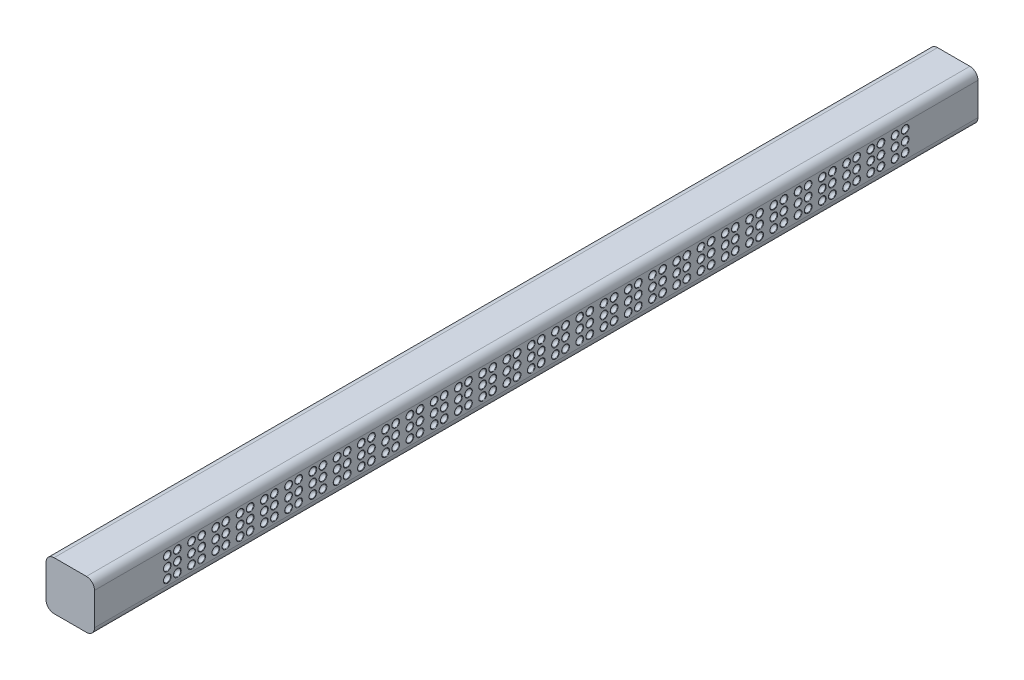
from build123d import *

# Parameters (mm, degrees)
BOSS_EXTRUDE1_DEPTH    = 218.5
SKETCH3_R              = 0.875
CUT_EXTRUDE1_DEPTH     = 1
FILLET1_R              = 0.875
FILLET2_R              = 0.1
LPATTERN1_COUNT        = 31
LPATTERN1_PITCH        = 6
FILLET1_OF_LPATTERN1_R = 0.875
FILLET2_OF_LPATTERN1_R = 0.1


with BuildPart() as part:
    # Sketch2 → Boss-Extrude1 (new body)
    with BuildSketch(Plane.XY):
        with BuildLine():
            Line((-4, 6), (4, 6))
            ThreePointArc((4, 6), (5.414213562, 5.414213562), (6, 4))
            Line((6, 4), (6, -4))
            ThreePointArc((6, -4), (5.414213562, -5.414213562), (4, -6))
            Line((4, -6), (-4, -6))
            ThreePointArc((-4, -6), (-5.414213562, -5.414213562), (-6, -4))
            Line((-6, -4), (-6, 4))
            ThreePointArc((-6, 4), (-5.414213562, 5.414213562), (-4, 6))
        make_face()
    extrude(amount=BOSS_EXTRUDE1_DEPTH)

    # Sketch3 → Cut-Extrude1 (cut)
    with BuildSketch(Plane(origin=(6, 0, 0), x_dir=(0, 0, -1), z_dir=(1, 0, 0))):
        with Locations((-20.5, -2.5)):
            Circle(SKETCH3_R)
        with Locations((-18, -2.5)):
            Circle(SKETCH3_R)
        with Locations((-18, 0)):
            Circle(SKETCH3_R)
        with Locations((-18, 2.5)):
            Circle(SKETCH3_R)
        with Locations((-20.5, 0)):
            Circle(SKETCH3_R)
        with Locations((-20.5, 2.5)):
            Circle(SKETCH3_R)
    cut_extrude1 = extrude(amount=-CUT_EXTRUDE1_DEPTH, mode=Mode.SUBTRACT)

    # Fillet1
    fillet1_edges = [part.edges().sort_by_distance(p)[0] for p in [
        (5, 2.5, 18.875),
        (5, 2.5, 21.375),
        (5, 0, 21.375),
        (5, 0, 18.875),
        (5, -2.5, 18.875),
        (5, -2.5, 21.375),
    ]]
    fillet(fillet1_edges, radius=FILLET1_R)

    # Fillet2
    fillet2_edges = [part.edges().sort_by_distance(p)[0] for p in [
        (6, -2.5, 18.875),
        (6, -2.5, 21.375),
        (6, 0, 21.375),
        (6, 2.5, 21.375),
        (6, 2.5, 18.875),
        (6, 0, 18.875),
    ]]
    fillet(fillet2_edges, radius=FILLET2_R)

    # LPattern1: Cut-Extrude1 ×31
    with Locations(*[(0, 0, i * LPATTERN1_PITCH) for i in range(1, LPATTERN1_COUNT)]):
        add(cut_extrude1, mode=Mode.SUBTRACT)

    # Fillet1 of LPattern1
    fillet1_of_lpattern1_edges = [part.edges().sort_by_distance(p)[0] for p in [
        (5, 2.5, 24.875),
        (5, 2.5, 27.375),
        (5, 0, 27.375),
        (5, 0, 24.875),
        (5, -2.5, 24.875),
        (5, -2.5, 27.375),
        (5, 2.5, 30.875),
        (5, 2.5, 33.375),
        (5, 0, 33.375),
        (5, 0, 30.875),
        (5, -2.5, 30.875),
        (5, -2.5, 33.375),
        (5, 2.5, 36.875),
        (5, 2.5, 39.375),
        (5, 0, 39.375),
        (5, 0, 36.875),
        (5, -2.5, 36.875),
        (5, -2.5, 39.375),
        (5, 2.5, 42.875),
        (5, 2.5, 45.375),
        (5, 0, 45.375),
        (5, 0, 42.875),
        (5, -2.5, 42.875),
        (5, -2.5, 45.375),
        (5, 2.5, 48.875),
        (5, 2.5, 51.375),
        (5, 0, 51.375),
        (5, 0, 48.875),
        (5, -2.5, 48.875),
        (5, -2.5, 51.375),
        (5, 2.5, 54.875),
        (5, 2.5, 57.375),
        (5, 0, 57.375),
        (5, 0, 54.875),
        (5, -2.5, 54.875),
        (5, -2.5, 57.375),
        (5, 2.5, 60.875),
        (5, 2.5, 63.375),
        (5, 0, 63.375),
        (5, 0, 60.875),
        (5, -2.5, 60.875),
        (5, -2.5, 63.375),
        (5, 2.5, 66.875),
        (5, 2.5, 69.375),
        (5, 0, 69.375),
        (5, 0, 66.875),
        (5, -2.5, 66.875),
        (5, -2.5, 69.375),
        (5, 2.5, 72.875),
        (5, 2.5, 75.375),
        (5, 0, 75.375),
        (5, 0, 72.875),
        (5, -2.5, 72.875),
        (5, -2.5, 75.375),
        (5, 2.5, 78.875),
        (5, 2.5, 81.375),
        (5, 0, 81.375),
        (5, 0, 78.875),
        (5, -2.5, 78.875),
        (5, -2.5, 81.375),
        (5, 2.5, 84.875),
        (5, 2.5, 87.375),
        (5, 0, 87.375),
        (5, 0, 84.875),
        (5, -2.5, 84.875),
        (5, -2.5, 87.375),
        (5, 2.5, 90.875),
        (5, 2.5, 93.375),
        (5, 0, 93.375),
        (5, 0, 90.875),
        (5, -2.5, 90.875),
        (5, -2.5, 93.375),
        (5, 2.5, 96.875),
        (5, 2.5, 99.375),
        (5, 0, 99.375),
        (5, 0, 96.875),
        (5, -2.5, 96.875),
        (5, -2.5, 99.375),
        (5, 2.5, 102.875),
        (5, 2.5, 105.375),
        (5, 0, 105.375),
        (5, 0, 102.875),
        (5, -2.5, 102.875),
        (5, -2.5, 105.375),
        (5, 2.5, 108.875),
        (5, 2.5, 111.375),
        (5, 0, 111.375),
        (5, 0, 108.875),
        (5, -2.5, 108.875),
        (5, -2.5, 111.375),
        (5, 2.5, 114.875),
        (5, 2.5, 117.375),
        (5, 0, 117.375),
        (5, 0, 114.875),
        (5, -2.5, 114.875),
        (5, -2.5, 117.375),
        (5, 2.5, 120.875),
        (5, 2.5, 123.375),
        (5, 0, 123.375),
        (5, 0, 120.875),
        (5, -2.5, 120.875),
        (5, -2.5, 123.375),
        (5, 2.5, 126.875),
        (5, 2.5, 129.375),
        (5, 0, 129.375),
        (5, 0, 126.875),
        (5, -2.5, 126.875),
        (5, -2.5, 129.375),
        (5, 2.5, 132.875),
        (5, 2.5, 135.375),
        (5, 0, 135.375),
        (5, 0, 132.875),
        (5, -2.5, 132.875),
        (5, -2.5, 135.375),
        (5, 2.5, 138.875),
        (5, 2.5, 141.375),
        (5, 0, 141.375),
        (5, 0, 138.875),
        (5, -2.5, 138.875),
        (5, -2.5, 141.375),
        (5, 2.5, 144.875),
        (5, 2.5, 147.375),
        (5, 0, 147.375),
        (5, 0, 144.875),
        (5, -2.5, 144.875),
        (5, -2.5, 147.375),
        (5, 2.5, 150.875),
        (5, 2.5, 153.375),
        (5, 0, 153.375),
        (5, 0, 150.875),
        (5, -2.5, 150.875),
        (5, -2.5, 153.375),
        (5, 2.5, 156.875),
        (5, 2.5, 159.375),
        (5, 0, 159.375),
        (5, 0, 156.875),
        (5, -2.5, 156.875),
        (5, -2.5, 159.375),
        (5, 2.5, 162.875),
        (5, 2.5, 165.375),
        (5, 0, 165.375),
        (5, 0, 162.875),
        (5, -2.5, 162.875),
        (5, -2.5, 165.375),
        (5, 2.5, 168.875),
        (5, 2.5, 171.375),
        (5, 0, 171.375),
        (5, 0, 168.875),
        (5, -2.5, 168.875),
        (5, -2.5, 171.375),
        (5, 2.5, 174.875),
        (5, 2.5, 177.375),
        (5, 0, 177.375),
        (5, 0, 174.875),
        (5, -2.5, 174.875),
        (5, -2.5, 177.375),
        (5, 2.5, 180.875),
        (5, 2.5, 183.375),
        (5, 0, 183.375),
        (5, 0, 180.875),
        (5, -2.5, 180.875),
        (5, -2.5, 183.375),
        (5, 2.5, 186.875),
        (5, 2.5, 189.375),
        (5, 0, 189.375),
        (5, 0, 186.875),
        (5, -2.5, 186.875),
        (5, -2.5, 189.375),
        (5, 2.5, 192.875),
        (5, 2.5, 195.375),
        (5, 0, 195.375),
        (5, 0, 192.875),
        (5, -2.5, 192.875),
        (5, -2.5, 195.375),
        (5, 2.5, 198.875),
        (5, 2.5, 201.375),
        (5, 0, 201.375),
        (5, 0, 198.875),
        (5, -2.5, 198.875),
        (5, -2.5, 201.375),
    ]]
    fillet(fillet1_of_lpattern1_edges, radius=FILLET1_OF_LPATTERN1_R)

    # Fillet2 of LPattern1
    fillet2_of_lpattern1_edges = [part.edges().sort_by_distance(p)[0] for p in [
        (6, -2.5, 24.875),
        (6, -2.5, 27.375),
        (6, 0, 27.375),
        (6, 2.5, 27.375),
        (6, 2.5, 24.875),
        (6, 0, 24.875),
        (6, -2.5, 30.875),
        (6, -2.5, 33.375),
        (6, 0, 33.375),
        (6, 2.5, 33.375),
        (6, 2.5, 30.875),
        (6, 0, 30.875),
        (6, -2.5, 36.875),
        (6, -2.5, 39.375),
        (6, 0, 39.375),
        (6, 2.5, 39.375),
        (6, 2.5, 36.875),
        (6, 0, 36.875),
        (6, -2.5, 42.875),
        (6, -2.5, 45.375),
        (6, 0, 45.375),
        (6, 2.5, 45.375),
        (6, 2.5, 42.875),
        (6, 0, 42.875),
        (6, -2.5, 48.875),
        (6, -2.5, 51.375),
        (6, 0, 51.375),
        (6, 2.5, 51.375),
        (6, 2.5, 48.875),
        (6, 0, 48.875),
        (6, -2.5, 54.875),
        (6, -2.5, 57.375),
        (6, 0, 57.375),
        (6, 2.5, 57.375),
        (6, 2.5, 54.875),
        (6, 0, 54.875),
        (6, -2.5, 60.875),
        (6, -2.5, 63.375),
        (6, 0, 63.375),
        (6, 2.5, 63.375),
        (6, 2.5, 60.875),
        (6, 0, 60.875),
        (6, -2.5, 66.875),
        (6, -2.5, 69.375),
        (6, 0, 69.375),
        (6, 2.5, 69.375),
        (6, 2.5, 66.875),
        (6, 0, 66.875),
        (6, -2.5, 72.875),
        (6, -2.5, 75.375),
        (6, 0, 75.375),
        (6, 2.5, 75.375),
        (6, 2.5, 72.875),
        (6, 0, 72.875),
        (6, -2.5, 78.875),
        (6, -2.5, 81.375),
        (6, 0, 81.375),
        (6, 2.5, 81.375),
        (6, 2.5, 78.875),
        (6, 0, 78.875),
        (6, -2.5, 84.875),
        (6, -2.5, 87.375),
        (6, 0, 87.375),
        (6, 2.5, 87.375),
        (6, 2.5, 84.875),
        (6, 0, 84.875),
        (6, -2.5, 90.875),
        (6, -2.5, 93.375),
        (6, 0, 93.375),
        (6, 2.5, 93.375),
        (6, 2.5, 90.875),
        (6, 0, 90.875),
        (6, -2.5, 96.875),
        (6, -2.5, 99.375),
        (6, 0, 99.375),
        (6, 2.5, 99.375),
        (6, 2.5, 96.875),
        (6, 0, 96.875),
        (6, -2.5, 102.875),
        (6, -2.5, 105.375),
        (6, 0, 105.375),
        (6, 2.5, 105.375),
        (6, 2.5, 102.875),
        (6, 0, 102.875),
        (6, -2.5, 108.875),
        (6, -2.5, 111.375),
        (6, 0, 111.375),
        (6, 2.5, 111.375),
        (6, 2.5, 108.875),
        (6, 0, 108.875),
        (6, -2.5, 114.875),
        (6, -2.5, 117.375),
        (6, 0, 117.375),
        (6, 2.5, 117.375),
        (6, 2.5, 114.875),
        (6, 0, 114.875),
        (6, -2.5, 120.875),
        (6, -2.5, 123.375),
        (6, 0, 123.375),
        (6, 2.5, 123.375),
        (6, 2.5, 120.875),
        (6, 0, 120.875),
        (6, -2.5, 126.875),
        (6, -2.5, 129.375),
        (6, 0, 129.375),
        (6, 2.5, 129.375),
        (6, 2.5, 126.875),
        (6, 0, 126.875),
        (6, -2.5, 132.875),
        (6, -2.5, 135.375),
        (6, 0, 135.375),
        (6, 2.5, 135.375),
        (6, 2.5, 132.875),
        (6, 0, 132.875),
        (6, -2.5, 138.875),
        (6, -2.5, 141.375),
        (6, 0, 141.375),
        (6, 2.5, 141.375),
        (6, 2.5, 138.875),
        (6, 0, 138.875),
        (6, -2.5, 144.875),
        (6, -2.5, 147.375),
        (6, 0, 147.375),
        (6, 2.5, 147.375),
        (6, 2.5, 144.875),
        (6, 0, 144.875),
        (6, -2.5, 150.875),
        (6, -2.5, 153.375),
        (6, 0, 153.375),
        (6, 2.5, 153.375),
        (6, 2.5, 150.875),
        (6, 0, 150.875),
        (6, -2.5, 156.875),
        (6, -2.5, 159.375),
        (6, 0, 159.375),
        (6, 2.5, 159.375),
        (6, 2.5, 156.875),
        (6, 0, 156.875),
        (6, -2.5, 162.875),
        (6, -2.5, 165.375),
        (6, 0, 165.375),
        (6, 2.5, 165.375),
        (6, 2.5, 162.875),
        (6, 0, 162.875),
        (6, -2.5, 168.875),
        (6, -2.5, 171.375),
        (6, 0, 171.375),
        (6, 2.5, 171.375),
        (6, 2.5, 168.875),
        (6, 0, 168.875),
        (6, -2.5, 174.875),
        (6, -2.5, 177.375),
        (6, 0, 177.375),
        (6, 2.5, 177.375),
        (6, 2.5, 174.875),
        (6, 0, 174.875),
        (6, -2.5, 180.875),
        (6, -2.5, 183.375),
        (6, 0, 183.375),
        (6, 2.5, 183.375),
        (6, 2.5, 180.875),
        (6, 0, 180.875),
        (6, -2.5, 186.875),
        (6, -2.5, 189.375),
        (6, 0, 189.375),
        (6, 2.5, 189.375),
        (6, 2.5, 186.875),
        (6, 0, 186.875),
        (6, -2.5, 192.875),
        (6, -2.5, 195.375),
        (6, 0, 195.375),
        (6, 2.5, 195.375),
        (6, 2.5, 192.875),
        (6, 0, 192.875),
        (6, -2.5, 198.875),
        (6, -2.5, 201.375),
        (6, 0, 201.375),
        (6, 2.5, 201.375),
        (6, 2.5, 198.875),
        (6, 0, 198.875),
    ]]
    fillet(fillet2_of_lpattern1_edges, radius=FILLET2_OF_LPATTERN1_R)


solid = part.part
